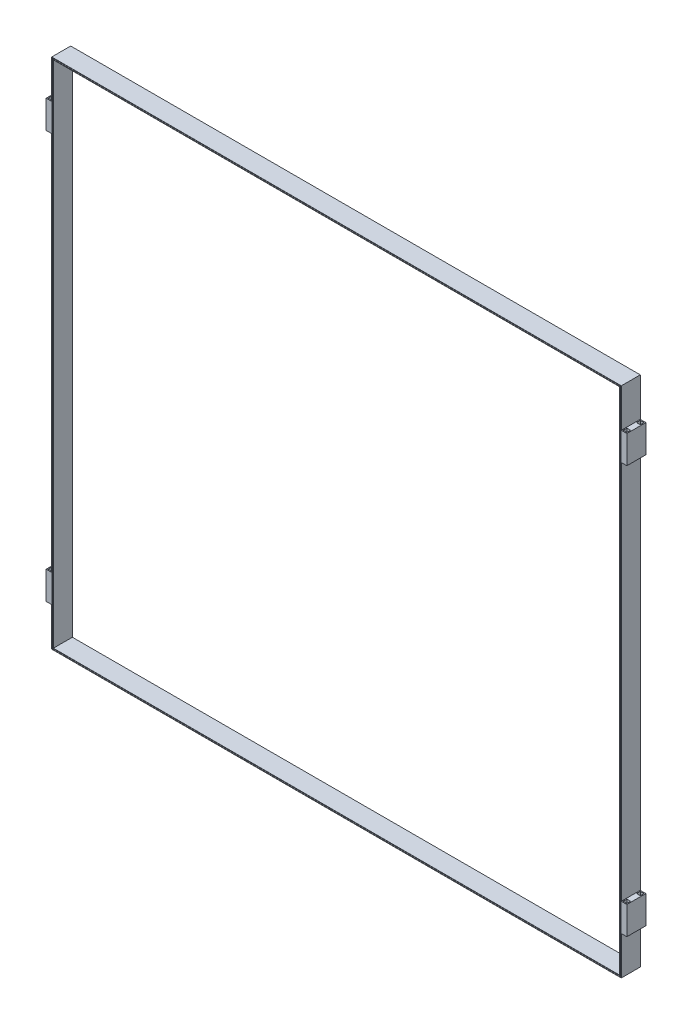
from build123d import *

# Parameters (mm, degrees)
SKETCH1_W               = 3058
SKETCH1_H               = 2753.2
SKETCH1_W_2             = 3048
SKETCH1_H_2             = 2743.2
BOSS_EXTRUDE1_DEPTH     = 100
SHELL4_T                = 2
SKETCH2_W               = 3058
SKETCH2_H               = 2753.2
SKETCH2_W_2             = 3048
SKETCH2_H_2             = 2743.2
CUT_EXTRUDE5_DEPTH      = 5
SKETCH3_W               = 102
SKETCH3_H               = 150
BOSS_EXTRUDE2_DEPTH     = 30
SKETCH4_W               = 20
SKETCH4_H               = 20
CUT_EXTRUDE6_DEPTH      = 100
SKETCH5_R               = 5
CUT_EXTRUDE7_DEPTH      = 50
SKETCH7_W               = 20
SKETCH7_H               = 20
CUT_EXTRUDE9_DEPTH      = 100
SKETCH9_R               = 5
CUT_EXTRUDE10_DEPTH     = 50
SKETCH8_R               = 5
CUT_EXTRUDE11_DEPTH     = 50
MIRROR2_START           = 1021.4
MIRROR2_OUTLINE_W       = 30
MIRROR2_OUTLINE_H       = 102
MIRROR2_DEPTH           = 150
MIRROR2_START_2         = -1171.4
MIRROR2_2_OUTLINE_W     = 30
MIRROR2_2_OUTLINE_H     = 102
MIRROR2_2_OUTLINE_W_2   = 20
MIRROR2_2_OUTLINE_H_2   = 20
MIRROR2_2_DEPTH         = 150
MIRROR2_3_OUTLINE_W     = 20
MIRROR2_3_OUTLINE_H     = 20
MIRROR2_3_OUTLINE_R     = 5
MIRROR2_3_DEPTH         = 50
SKETCH10_W              = 102
SKETCH10_H              = 7
BOSS_EXTRUDE3_DEPTH     = 2
MIRROR5_COPY_1_SKETCH_W = 102
MIRROR5_COPY_1_SKETCH_H = 7
MIRROR5_COPY_1_DEPTH    = 2


with BuildPart() as part:
    # Sketch1 → Boss-Extrude1 (new body)
    with BuildSketch(Plane.XY):
        Rectangle(SKETCH1_W, SKETCH1_H)
        Rectangle(SKETCH1_W_2, SKETCH1_H_2, mode=Mode.SUBTRACT)
    extrude(amount=BOSS_EXTRUDE1_DEPTH)

    # Shell4
    shell4_openings = [part.faces().sort_by_distance(p)[0] for p in [
        (-1524.885212735, 0, 100),
    ]]
    offset(amount=SHELL4_T, openings=shell4_openings, kind=Kind.INTERSECTION)

    # Sketch2 → Cut-Extrude5 (cut, symmetric)
    with BuildSketch(Plane.XY):
        Rectangle(SKETCH2_W, SKETCH2_H)
        Rectangle(SKETCH2_W_2, SKETCH2_H_2, mode=Mode.SUBTRACT)
    extrude(amount=CUT_EXTRUDE5_DEPTH, both=True, mode=Mode.SUBTRACT)


with BuildPart() as cut_extrude5_piece_1:
    # of the separate pieces the step leaves, piece 1, a body of its own (cut_extrude5_pieces)
    add(part.part.solids().sort_by_distance((-1529, -1376.6, -2))[0])

    # Sketch3 → Boss-Extrude2 (add)
    with BuildSketch(Plane.ZY.offset(1531)):
        with Locations((49, 1096.4)):
            Rectangle(SKETCH3_W, SKETCH3_H)
    boss_extrude2 = extrude(amount=BOSS_EXTRUDE2_DEPTH)

    # Mirror1: Boss-Extrude2 across plane
    add(boss_extrude2.mirror(Plane.ZX))

    # Sketch4 → Cut-Extrude6 (cut)
    with BuildSketch(Plane(origin=(0, 1171.4, 0), x_dir=(1, 0, 0), z_dir=(0, 1, 0))):
        with Locations((-1546, -85)):
            Rectangle(SKETCH4_W, SKETCH4_H)
        with Locations((-1546, -13)):
            Rectangle(SKETCH4_W, SKETCH4_H)
    cut_extrude6 = extrude(amount=-CUT_EXTRUDE6_DEPTH, mode=Mode.SUBTRACT)

    # Sketch5 → Cut-Extrude7 (cut)
    with BuildSketch(Plane(origin=(0, 1071.4, 0), x_dir=(1, 0, 0), z_dir=(0, 1, 0))):
        with Locations(Location((-1546, -85, 0), (0, 0, 270))):
            Circle(SKETCH5_R)
        with Locations(Location((-1546, -13, 0), (0, 0, 270))):
            Circle(SKETCH5_R)
    cut_extrude7 = extrude(amount=-CUT_EXTRUDE7_DEPTH, mode=Mode.SUBTRACT)

    # Sketch7 → Cut-Extrude9 (cut)
    with BuildSketch(Plane(origin=(0, -1021.4, 0), x_dir=(1, 0, 0), z_dir=(0, 1, 0))):
        with Locations((-1546, -85)):
            Rectangle(SKETCH7_W, SKETCH7_H)
        with Locations((-1546, -13)):
            Rectangle(SKETCH7_W, SKETCH7_H)
    extrude(amount=-CUT_EXTRUDE9_DEPTH, mode=Mode.SUBTRACT)

    # Sketch9 → Cut-Extrude10 (cut)
    with BuildSketch(Plane(origin=(0, -1121.4, 0), x_dir=(1, 0, 0), z_dir=(0, 1, 0))):
        with Locations(Location((-1546, -13, 0), (0, 0, 270))):
            Circle(SKETCH9_R)
    extrude(amount=-CUT_EXTRUDE10_DEPTH, mode=Mode.SUBTRACT)

    # Sketch8 → Cut-Extrude11 (cut)
    with BuildSketch(Plane(origin=(0, -1121.4, 0), x_dir=(1, 0, 0), z_dir=(0, 1, 0))):
        with Locations(Location((-1546, -85, 0), (0, 0, 270))):
            Circle(SKETCH8_R)
    extrude(amount=-CUT_EXTRUDE11_DEPTH, mode=Mode.SUBTRACT)

    # Mirror2: read off the stored shape, not the designer's step
    # Mirror2 outline → Mirror2 (add)
    with BuildSketch(Plane(origin=(0, 0, 0), x_dir=(1, 0, 0), z_dir=(0, 1, 0)).offset(MIRROR2_START)):
        with Locations((1546, -49)):
            Rectangle(MIRROR2_OUTLINE_W, MIRROR2_OUTLINE_H)
    extrude(amount=MIRROR2_DEPTH)

    # Mirror2 2 outline → Mirror2 2 (add)
    with BuildSketch(Plane(origin=(0, 0, 0), x_dir=(1, 0, 0), z_dir=(0, 1, 0)).offset(MIRROR2_START_2)):
        with Locations((1546, -49)):
            Rectangle(MIRROR2_2_OUTLINE_W, MIRROR2_2_OUTLINE_H)
        with Locations((1546, -85)):
            Rectangle(MIRROR2_2_OUTLINE_W_2, MIRROR2_2_OUTLINE_H_2, mode=Mode.SUBTRACT)
        with Locations((1546, -13)):
            Rectangle(MIRROR2_2_OUTLINE_W_2, MIRROR2_2_OUTLINE_H_2, mode=Mode.SUBTRACT)
    extrude(amount=MIRROR2_2_DEPTH)

    # Mirror2 3 outline → Mirror2 3 (add)
    # profile 1 of 2: a face of its own
    with BuildSketch(Plane(origin=(0, 0, 0), x_dir=(1, 0, 0), z_dir=(0, 1, 0)).offset(MIRROR2_START_2)):
        with Locations((1546, -85)):
            Rectangle(MIRROR2_3_OUTLINE_W, MIRROR2_3_OUTLINE_H)
        with Locations((1546, -85)):
            Circle(MIRROR2_3_OUTLINE_R, mode=Mode.SUBTRACT)
    # profile 2 of 2: a face of its own
    with BuildSketch(Plane(origin=(0, 0, 0), x_dir=(1, 0, 0), z_dir=(0, 1, 0)).offset(MIRROR2_START_2)):
        with Locations((1546, -13)):
            Rectangle(MIRROR2_3_OUTLINE_W, MIRROR2_3_OUTLINE_H)
        with Locations((1546, -13)):
            Circle(MIRROR2_3_OUTLINE_R, mode=Mode.SUBTRACT)
    extrude(amount=MIRROR2_3_DEPTH)

    # Mirror3: Cut-Extrude6, Cut-Extrude7 across plane
    add(cut_extrude6.mirror(Plane(origin=(0, 0, 0), x_dir=(0, 0, 1), z_dir=(1, 0, 0))), mode=Mode.SUBTRACT)
    add(cut_extrude7.mirror(Plane(origin=(0, 0, 0), x_dir=(0, 0, 1), z_dir=(1, 0, 0))), mode=Mode.SUBTRACT)



with BuildPart() as cut_extrude5_piece_2:
    # of the separate pieces the step leaves, piece 2, a body of its own (cut_extrude5_pieces)
    add(part.part.solids().sort_by_distance((-1524, 1371.6, -2))[0])


with BuildPart() as cut_extrude5_piece_1_1:
    add(cut_extrude5_piece_1.part)

    add(cut_extrude5_piece_2.part)  # Boss-Extrude3 merges Cut-Extrude5 piece 2
    # Sketch10 → Boss-Extrude3 (add)
    with BuildSketch(Plane(origin=(1524, 0, 0), x_dir=(0, 0, -1), z_dir=(1, 0, 0))):
        with Locations((-49, 1375.1)):
            Rectangle(SKETCH10_W, SKETCH10_H)
    boss_extrude3 = extrude(amount=-BOSS_EXTRUDE3_DEPTH)

    # Mirror4: Boss-Extrude3 across plane
    add(boss_extrude3.mirror(Plane.ZX))

    # Mirror5: Boss-Extrude3 across plane
    add(boss_extrude3.mirror(Plane(origin=(0, 0, 0), x_dir=(0, 0, 1), z_dir=(1, 0, 0))))

    # Mirror5 copy 1 sketch → Mirror5 copy 1 (add)
    with BuildSketch(Plane(origin=(-1524, 0, 0), x_dir=(0, 0, -1), z_dir=(-1, 0, 0))):
        with Locations((-49, 1375.1)):
            Rectangle(MIRROR5_COPY_1_SKETCH_W, MIRROR5_COPY_1_SKETCH_H)
    extrude(amount=-MIRROR5_COPY_1_DEPTH)


solid = cut_extrude5_piece_1_1.part
